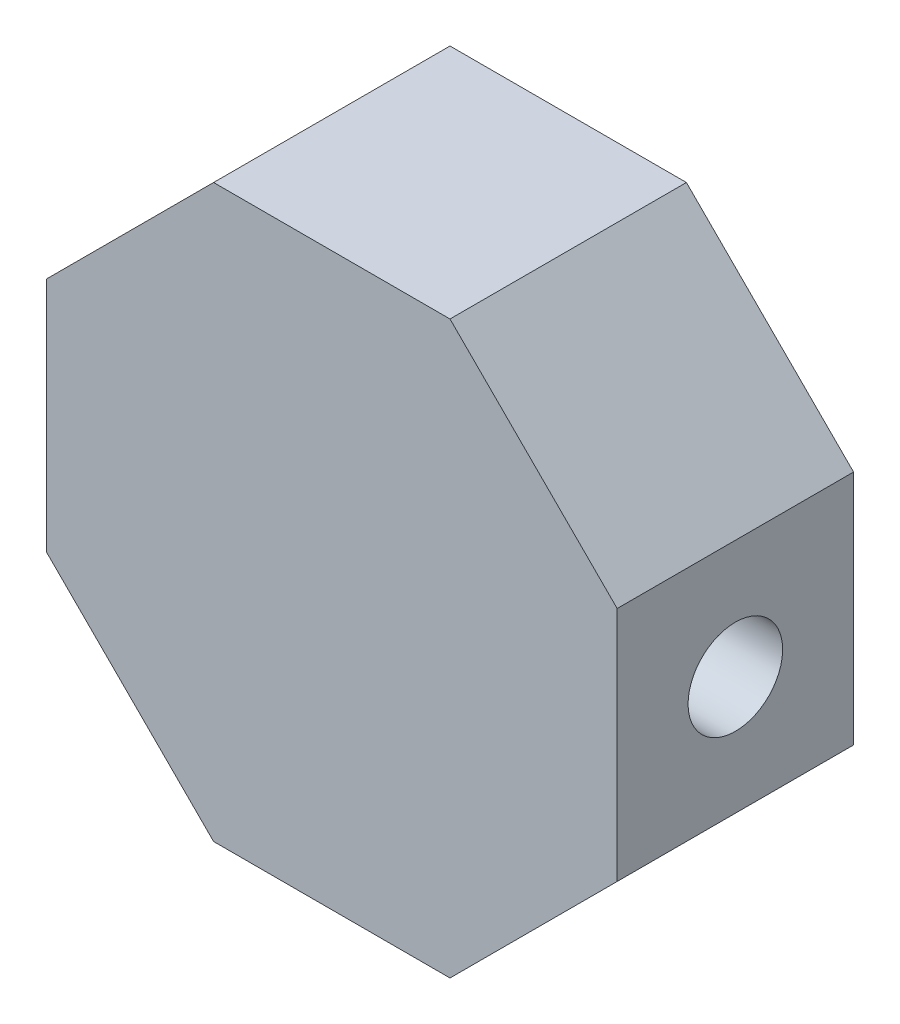
from build123d import *

# Parameters (mm, degrees)
BOSS_EXTRUDE1_DEPTH = 12.7
SKETCH3_R           = 2.54
CUT_EXTRUDE1_DEPTH  = 12.7
SKETCH4_R           = 3.175
CUT_EXTRUDE2_DEPTH  = 2.54


with BuildPart() as part:
    # Sketch2 → Boss-Extrude1 (new body)
    with BuildSketch(Plane.XY):
        Polygon((15.330256121, 6.35), (15.330256121, -6.35), (6.35, -15.330256121), (-6.35, -15.330256121), (-15.330256121, -6.35), (-15.330256121, 6.35), (-6.35, 15.330256121), (6.35, 15.330256121), align=None)
    extrude(amount=BOSS_EXTRUDE1_DEPTH)

    # Sketch3 → Cut-Extrude1 (cut)
    with BuildSketch(Plane(origin=(15.330256121, 0, 0), x_dir=(0, 0, -1), z_dir=(1, 0, 0))):
        with Locations((-6.35, 0)):
            Circle(SKETCH3_R)
    extrude(amount=-CUT_EXTRUDE1_DEPTH, mode=Mode.SUBTRACT)

    # Sketch4 → Cut-Extrude2 (cut)
    with BuildSketch(Plane(origin=(0, 0, 0), x_dir=(-1, 0, 0), z_dir=(0, 0, -1))):
        Circle(SKETCH4_R)
    extrude(amount=-CUT_EXTRUDE2_DEPTH, mode=Mode.SUBTRACT)


solid = part.part
